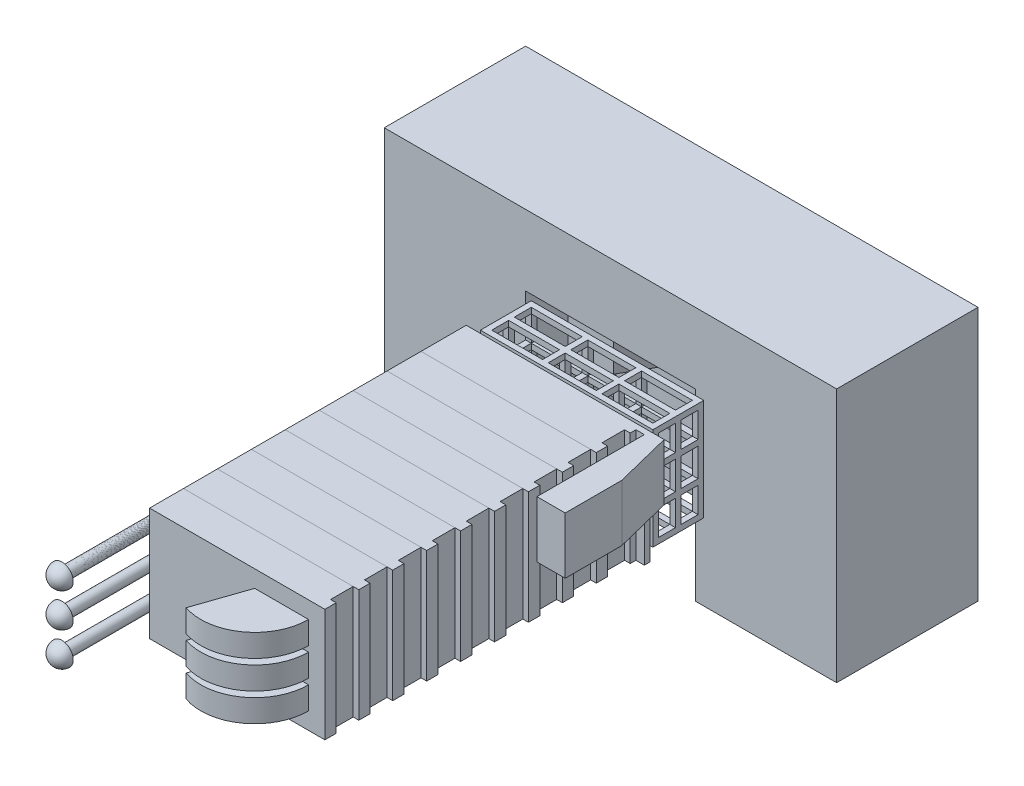
from build123d import *
from build123d.topology import SkipClean

# Parameters (mm, degrees)
SKETCH1_W             = 600
SKETCH1_H             = 400
SKETCH1_W_2           = 300
SKETCH1_H_2           = 346.666666667
SKETCH1_W_3           = 180
BOSS_EXTRUDE1_DEPTH   = 80
SKETCH2_W             = 620
SKETCH2_H             = 400
BOSS_EXTRUDE2_DEPTH   = 40
LPATTERN1_COUNT       = 9
LPATTERN1_PITCH       = 120
SKETCH3_W             = 530
SKETCH3_H             = 1040
CUT_EXTRUDE1_DEPTH    = 40
SKETCH4_W             = 620
SKETCH4_H             = 400
BOSS_EXTRUDE3_DEPTH   = 20
SKETCH5_W             = 650
SKETCH5_H             = 400
BOSS_EXTRUDE4_DEPTH   = 20
BOSS_EXTRUDE5_DEPTH   = 200
SKETCH8_R             = 20
BOSS_EXTRUDE6_DEPTH   = 1400
FILLET1_R             = 10
SKETCH10_W            = 150
SKETCH10_H            = 30
BOSS_EXTRUDE7_DEPTH   = 20
BOSS_EXTRUDE8_DEPTH   = 40
LPATTERN2_COUNT       = 2
LPATTERN2_PITCH       = 100
MIRROR1_COPY_1_DEPTH  = 40
MIRROR1_COPY_2_DEPTH  = 40
LPATTERN8_START       = -70
LPATTERN8_2_OUTLINE_R = 20
LPATTERN8_2_DEPTH     = 1430
LPATTERN8_3_DEPTH     = 30
FILLET2_R             = 10
FILLET2_OF_MIRROR3_R  = 10
SKETCH12_W            = 20
SKETCH12_H            = 90
SKETCH12_W_2          = 180
SKETCH12_H_2          = 20
SKETCH12_H_3          = 100
SKETCH12_W_3          = 170
SKETCH12_H_4          = 40
BOSS_EXTRUDE9_DEPTH   = 20
LPATTERN9_COUNT       = 3
LPATTERN9_PITCH       = 80
SKETCH13_W            = 20
SKETCH13_H            = 20
BOSS_EXTRUDE10_DEPTH  = 180
SKETCH15_W            = 1600
SKETCH15_H            = 900
BOSS_EXTRUDE12_DEPTH  = 500
SKETCH16_W            = 600
SKETCH16_H            = 400
CUT_EXTRUDE2_DEPTH    = 150
SKETCH17_W            = 360
SKETCH17_H            = 240
CUT_EXTRUDE3_DEPTH    = 150
CUT_EXTRUDE3_DRAFT    = -30
SKETCH18_W            = 600
SKETCH18_H            = 320
CUT_EXTRUDE4_DEPTH    = 400
BOSS_EXTRUDE13_DEPTH  = 10


with BuildPart() as part:
    # Sketch1 → Boss-Extrude1 (new body)
    with BuildSketch(Plane.XY):
        Rectangle(SKETCH1_W, SKETCH1_H)
        with Locations((-100, -6.666666666)):
            Rectangle(SKETCH1_W_2, SKETCH1_H_2, mode=Mode.SUBTRACT)
        with Locations((190, -6.666666666)):
            Rectangle(SKETCH1_W_3, SKETCH1_H_2, mode=Mode.SUBTRACT)
    extrude(amount=BOSS_EXTRUDE1_DEPTH)

    # Sketch2 → Boss-Extrude2 (add)
    with BuildSketch(Plane.XY.offset(80)):
        with Locations((10, 0)):
            Rectangle(SKETCH2_W, SKETCH2_H)
    extrude(amount=BOSS_EXTRUDE2_DEPTH)


with BuildPart() as lpattern1_1:
    # LPattern1: pattern copy
    add(part.part.moved(Location(Vector(0, 0, 1) * (1 * LPATTERN1_PITCH))))


with BuildPart() as lpattern1_2:
    # LPattern1: pattern copy
    add(part.part.moved(Location(Vector(0, 0, 1) * (2 * LPATTERN1_PITCH))))


with BuildPart() as lpattern1_3:
    # LPattern1: pattern copy
    add(part.part.moved(Location(Vector(0, 0, 1) * (3 * LPATTERN1_PITCH))))


with BuildPart() as lpattern1_4:
    # LPattern1: pattern copy
    add(part.part.moved(Location(Vector(0, 0, 1) * (4 * LPATTERN1_PITCH))))


with BuildPart() as lpattern1_5:
    # LPattern1: pattern copy
    add(part.part.moved(Location(Vector(0, 0, 1) * (5 * LPATTERN1_PITCH))))


with BuildPart() as lpattern1_6:
    # LPattern1: pattern copy
    add(part.part.moved(Location(Vector(0, 0, 1) * (6 * LPATTERN1_PITCH))))


with BuildPart() as lpattern1_7:
    # LPattern1: pattern copy
    add(part.part.moved(Location(Vector(0, 0, 1) * (7 * LPATTERN1_PITCH))))


with BuildPart() as lpattern1_8:
    # LPattern1: pattern copy
    add(part.part.moved(Location(Vector(0, 0, 1) * (8 * LPATTERN1_PITCH))))


with BuildPart() as cut_extrude1_tool:
    # Sketch3 → Cut-Extrude1 (new body)
    with BuildSketch(Plane.XZ.offset(200)):
        with Locations((15, 520)):
            Rectangle(SKETCH3_W, SKETCH3_H)
    extrude(amount=-CUT_EXTRUDE1_DEPTH)


with BuildPart() as part_1:
    add(part.part)

    # Cut-Extrude1: cut by cut_extrude1_tool
    add(cut_extrude1_tool.part, mode=Mode.SUBTRACT)

    # Sketch4 → Boss-Extrude3 (add)
    with BuildSketch(Plane(origin=(0, 0, 0), x_dir=(-1, 0, 0), z_dir=(0, 0, -1))):
        with Locations((-10, 0)):
            Rectangle(SKETCH4_W, SKETCH4_H)
    extrude(amount=BOSS_EXTRUDE3_DEPTH)

    # Sketch5 → Boss-Extrude4 (add)
    with BuildSketch(Plane(origin=(0, 0, -20), x_dir=(-1, 0, 0), z_dir=(0, 0, -1))):
        with Locations((-25, 0)):
            Rectangle(SKETCH5_W, SKETCH5_H)
    extrude(amount=BOSS_EXTRUDE4_DEPTH)

    # Sketch6 → Boss-Extrude5 (add)
    with BuildSketch(Plane(origin=(0, 0, 0), x_dir=(1, 0, 0), z_dir=(0, 1, 0))):
        Polygon((400, 40), (350, 40), (350, -360), (450, -360), (450, -160), align=None)
    extrude(amount=BOSS_EXTRUDE5_DEPTH)



with BuildPart() as lpattern1_1_1:
    add(lpattern1_1.part)

    # Cut-Extrude1: cut by cut_extrude1_tool
    add(cut_extrude1_tool.part, mode=Mode.SUBTRACT)


with BuildPart() as lpattern1_2_1:
    add(lpattern1_2.part)

    # Cut-Extrude1: cut by cut_extrude1_tool
    add(cut_extrude1_tool.part, mode=Mode.SUBTRACT)


with BuildPart() as lpattern1_3_1:
    add(lpattern1_3.part)

    # Cut-Extrude1: cut by cut_extrude1_tool
    add(cut_extrude1_tool.part, mode=Mode.SUBTRACT)


with BuildPart() as lpattern1_4_1:
    add(lpattern1_4.part)

    # Cut-Extrude1: cut by cut_extrude1_tool
    add(cut_extrude1_tool.part, mode=Mode.SUBTRACT)


with BuildPart() as lpattern1_5_1:
    add(lpattern1_5.part)

    # Cut-Extrude1: cut by cut_extrude1_tool
    add(cut_extrude1_tool.part, mode=Mode.SUBTRACT)


with BuildPart() as lpattern1_6_1:
    add(lpattern1_6.part)

    # Cut-Extrude1: cut by cut_extrude1_tool
    add(cut_extrude1_tool.part, mode=Mode.SUBTRACT)


with BuildPart() as lpattern1_7_1:
    add(lpattern1_7.part)

    # Cut-Extrude1: cut by cut_extrude1_tool
    add(cut_extrude1_tool.part, mode=Mode.SUBTRACT)


with BuildPart() as lpattern1_8_1:
    add(lpattern1_8.part)

    # Cut-Extrude1: cut by cut_extrude1_tool
    add(cut_extrude1_tool.part, mode=Mode.SUBTRACT)

    # Sketch11 → Boss-Extrude8 (add, symmetric)
    with BuildSketch(Plane(origin=(0, 0, 0), x_dir=(1, 0, 0), z_dir=(0, 1, 0))):
        with BuildLine():
            Line((10, -1260.443860597), (71.738792263, -1080))
            Line((71.738792263, -1080), (262.452360991, -1080))
            ThreePointArc((262.452360991, -1080), (182.637935397, -1235.15490759), (10, -1260.443860597))
        make_face()
    boss_extrude8 = extrude(amount=BOSS_EXTRUDE8_DEPTH, both=True)

    # LPattern2: Boss-Extrude8 ×2
    with Locations(*[(0, i * LPATTERN2_PITCH, 0) for i in range(1, LPATTERN2_COUNT)]):
        add(boss_extrude8)

    # Mirror1 copy 1 sketch → Mirror1 copy 1 (add, symmetric)
    with BuildSketch(Plane.XZ.offset(100)):
        with BuildLine():
            Line((10, 1260.443860597), (71.738792263, 1080))
            Line((71.738792263, 1080), (262.452360991, 1080))
            ThreePointArc((262.452360991, 1080), (182.637935397, 1235.15490759), (10, 1260.443860597))
        make_face()
    extrude(amount=MIRROR1_COPY_1_DEPTH, both=True)

    # Mirror1 copy 2 sketch → Mirror1 copy 2 (add, symmetric)
    with BuildSketch(Plane.XZ):
        with BuildLine():
            Line((10, 1260.443860597), (71.738792263, 1080))
            Line((71.738792263, 1080), (262.452360991, 1080))
            ThreePointArc((262.452360991, 1080), (182.637935397, 1235.15490759), (10, 1260.443860597))
        make_face()
    extrude(amount=MIRROR1_COPY_2_DEPTH, both=True)


with BuildPart() as body_10:
    # Sketch8 → Boss-Extrude6 (new body)
    with BuildSketch(Plane(origin=(0, 0, -40), x_dir=(-1, 0, 0), z_dir=(0, 0, -1))):
        with Locations((330, 0)):
            Circle(SKETCH8_R)
    extrude(amount=-BOSS_EXTRUDE6_DEPTH)

    # Sketch9 → Revolve1 (revolve)
    with SkipClean():  # the faces are left unmerged after this step: merging them gives an invalid solid
        with BuildSketch(Plane(origin=(0, 0, 0), x_dir=(1, 0, 0), z_dir=(0, 1, 0)), mode=Mode.PRIVATE) as revolve1_sk:
            with BuildLine():
                Line((-330, -1360), (-370, -1360))
                ThreePointArc((-370, -1360), (-358.284271247, -1388.284271247), (-330, -1400))
                Line((-330, -1400), (-330, -1360))
            make_face()
            with BuildLine():
                Line((-290, -1360), (-330, -1360))
                Line((-330, -1360), (-330, -1400))
                ThreePointArc((-330, -1400), (-301.715728753, -1388.284271247), (-290, -1360))
            make_face()
        revolve(revolve1_sk.sketch.rotate(Axis((-330, 0, 1293.375823625), (0, 0, 1)), 180), axis=Axis((-330, 0, 1293.375823625), (0, 0, 1)))
    add(body_10.part.scale(1), mode=Mode.REPLACE)  # the faces are merged on a copy

    # Fillet1
    fillet1_edges = [body_10.edges().sort_by_distance(p)[0] for p in [
        (-310, 0, 1360),
    ]]
    fillet(fillet1_edges, radius=FILLET1_R)


with BuildPart() as part_2:
    add(part_1.part)

    add(body_10.part)  # Boss-Extrude7 merges body 10
    # Sketch10 → Boss-Extrude7 (add, symmetric)
    with BuildSketch(Plane(origin=(0, 0, 0), x_dir=(1, 0, 0), z_dir=(0, 1, 0))):
        with Locations((-275, 55)):
            Rectangle(SKETCH10_W, SKETCH10_H)
    extrude(amount=BOSS_EXTRUDE7_DEPTH, both=True)

    # LPattern8 2 outline → LPattern8 2 (add)
    with BuildSketch(Plane.XY.offset(LPATTERN8_START)):
        with Locations((-330, 120)):
            Circle(LPATTERN8_2_OUTLINE_R)
    lpattern8_2 = extrude(amount=LPATTERN8_2_DEPTH)

    # LPattern8 3 outline → LPattern8 3 (add)
    with BuildSketch(Plane.XY.offset(LPATTERN8_START)):
        with BuildLine():
            Line((-350, 120), (-350, 100))
            Line((-350, 100), (-330, 100))
            ThreePointArc((-330, 100), (-344.142135624, 105.857864376), (-350, 120))
        make_face()
        with BuildLine():
            Line((-350, 140), (-350, 120))
            ThreePointArc((-350, 120), (-344.142135624, 134.142135624), (-330, 140))
            Line((-330, 140), (-350, 140))
        make_face()
        with BuildLine():
            ThreePointArc((-330, 140), (-310, 120), (-330, 100))
            Line((-330, 100), (-200, 100))
            Line((-200, 100), (-200, 140))
            Line((-200, 140), (-330, 140))
        make_face()
    lpattern8_3 = extrude(amount=LPATTERN8_3_DEPTH)

    # LPattern8 4 outline → LPattern8 4 (revolve)
    with BuildSketch(Plane(origin=(-330, 120, 0), x_dir=(1, 0, 0), z_dir=(0, -1, 0))):
        with BuildLine():
            Line((0, 1359.99999998), (40, 1359.99999996))
            ThreePointArc((40, 1359.99999996), (28.284271262, 1388.284271233), (0, 1400))
            Line((0, 1400), (0, 1359.99999998))
        make_face()
    lpattern8_4 = revolve(axis=Axis((-330, 120, 0), (0, 0, 1)))

    # Fillet2
    fillet2_edges = [part_2.edges().sort_by_distance(p)[0] for p in [
        (-350, 120, 1360),
    ]]
    fillet(fillet2_edges, radius=FILLET2_R)


with BuildPart() as body_10_2:
    # LPattern8: read off the stored shape, not the designer's step
    # LPattern8 outline → LPattern8 (revolve)
    with BuildSketch(Plane(origin=(-330, 120, 0), x_dir=(1, 0, 0), z_dir=(0, -1, 0))):
        with BuildLine():
            ThreePointArc((40, 1359.99999998), (28.284271255, 1388.28427124), (0, 1400))
            Line((0, 1400), (0, -40))
            Line((0, -40), (20, -40))
            Line((20, -40), (20, 1360))
            Line((20, 1360), (40, 1359.99999998))
        make_face()
    lpattern8 = revolve(axis=Axis((-330, 120, 0), (0, 0, 1)))


with BuildPart() as part_3:
    add(part_2.part)

    # Mirror3: LPattern8, LPattern8 2, LPattern8 3, LPattern8 4 across plane
    add(lpattern8.mirror(Plane.ZX))
    add(lpattern8_2.mirror(Plane.ZX))
    add(lpattern8_3.mirror(Plane.ZX))
    add(lpattern8_4.mirror(Plane.ZX))

    # Fillet2 of Mirror3
    fillet2_of_mirror3_edges = [part_3.edges().sort_by_distance(p)[0] for p in [
        (-350, -120, 1360),
    ]]
    fillet(fillet2_of_mirror3_edges, radius=FILLET2_OF_MIRROR3_R)

    # Sketch12 → Boss-Extrude9 (add)
    with BuildSketch(Plane(origin=(0, 0, -70), x_dir=(-1, 0, 0), z_dir=(0, 0, -1))):
        Polygon((280, -100), (280, 180), (-330, 180), (-330, -180), (280, -180), (280, -140), (260, -140), (260, -160), (80, -160), (60, -160), (-110, -160), (-130, -160), (-310, -160), (-310, -70), (-310, -50), (-310, 50), (-310, 70), (-310, 160), (-130, 160), (-110, 160), (60, 160), (80, 160), (260, 160), (260, 70), (260, 50), (260, -50), (260, -70), (260, -100), align=None)
        with Locations((-120, 115)):
            Rectangle(SKETCH12_W, SKETCH12_H)
        with Locations((-220, 60)):
            Rectangle(SKETCH12_W_2, SKETCH12_H_2)
        with Locations((-120, 60)):
            Rectangle(SKETCH12_W, SKETCH12_H_2)
        with Locations((-120, 0)):
            Rectangle(SKETCH12_W, SKETCH12_H_3)
        with Locations((-220, -60)):
            Rectangle(SKETCH12_W_2, SKETCH12_H_2)
        with Locations((-120, -60)):
            Rectangle(SKETCH12_W, SKETCH12_H_2)
        with Locations((-120, -115)):
            Rectangle(SKETCH12_W, SKETCH12_H)
        with Locations((-25, -60)):
            Rectangle(SKETCH12_W_3, SKETCH12_H_2)
        with Locations((70, -60)):
            Rectangle(SKETCH12_W, SKETCH12_H_2)
        with Locations((70, -115)):
            Rectangle(SKETCH12_W, SKETCH12_H)
        with Locations((170, -60)):
            Rectangle(SKETCH12_W_2, SKETCH12_H_2)
        with Locations((70, 60)):
            Rectangle(SKETCH12_W, SKETCH12_H_2)
        with Locations((-25, 60)):
            Rectangle(SKETCH12_W_3, SKETCH12_H_2)
        with Locations((70, 115)):
            Rectangle(SKETCH12_W, SKETCH12_H)
        with Locations((170, 60)):
            Rectangle(SKETCH12_W_2, SKETCH12_H_2)
        with Locations((270, -120)):
            Rectangle(SKETCH12_W, SKETCH12_H_4)
        with Locations((70, 0)):
            Rectangle(SKETCH12_W, SKETCH12_H_3)
    boss_extrude9 = extrude(amount=BOSS_EXTRUDE9_DEPTH)



with BuildPart() as lpattern9_1:
    # LPattern9: Boss-Extrude9 ×3
    with Locations(*[(0, 0, -i * LPATTERN9_PITCH) for i in range(1, LPATTERN9_COUNT)]):
        add(boss_extrude9)


with BuildPart() as part_4:
    add(part_3.part)

    add(lpattern9_1.part)  # Boss-Extrude10 merges LPattern9_1
    # Sketch13 → Boss-Extrude10 (add)
    with BuildSketch(Plane(origin=(0, 0, -250), x_dir=(-1, 0, 0), z_dir=(0, 0, -1))):
        with Locations((270, 170)):
            Rectangle(SKETCH13_W, SKETCH13_H)
        with Locations((270, 60)):
            Rectangle(SKETCH13_W, SKETCH13_H)
        with Locations((270, -60)):
            Rectangle(SKETCH13_W, SKETCH13_H)
        with Locations((270, -170)):
            Rectangle(SKETCH13_W, SKETCH13_H)
        with Locations((70, -170)):
            Rectangle(SKETCH13_W, SKETCH13_H)
        with Locations((70, -60)):
            Rectangle(SKETCH13_W, SKETCH13_H)
        with Locations((70, 60)):
            Rectangle(SKETCH13_W, SKETCH13_H)
        with Locations((70, 170)):
            Rectangle(SKETCH13_W, SKETCH13_H)
        with Locations((-120, 170)):
            Rectangle(SKETCH13_W, SKETCH13_H)
        with Locations((-120, -60)):
            Rectangle(SKETCH13_W, SKETCH13_H)
        with Locations((-120, 60)):
            Rectangle(SKETCH13_W, SKETCH13_H)
        with Locations((-120, -170)):
            Rectangle(SKETCH13_W, SKETCH13_H)
        with Locations((-320, -170)):
            Rectangle(SKETCH13_W, SKETCH13_H)
        with Locations((-320, -60)):
            Rectangle(SKETCH13_W, SKETCH13_H)
        with Locations((-320, 60)):
            Rectangle(SKETCH13_W, SKETCH13_H)
        with Locations((-320, 170)):
            Rectangle(SKETCH13_W, SKETCH13_H)
    extrude(amount=-BOSS_EXTRUDE10_DEPTH)

    # Sketch19 → Boss-Extrude13 (add)
    with BuildSketch(Plane(origin=(0, 0, 0), x_dir=(1, 0, 0), z_dir=(0, 1, 0))):
        Polygon((400, 40), (330, 70), (305, 70), (375, 40), align=None)
    extrude(amount=BOSS_EXTRUDE13_DEPTH)


with BuildPart() as body_11:
    # Sketch15 → Boss-Extrude12 (new body)
    with BuildSketch(Plane(origin=(0, 0, -250), x_dir=(-1, 0, 0), z_dir=(0, 0, -1))):
        Rectangle(SKETCH15_W, SKETCH15_H)
    extrude(amount=BOSS_EXTRUDE12_DEPTH)

    # Sketch16 → Cut-Extrude2 (cut)
    with BuildSketch(Plane.XY.offset(-250)):
        Rectangle(SKETCH16_W, SKETCH16_H)
    extrude(amount=-CUT_EXTRUDE2_DEPTH, mode=Mode.SUBTRACT)


with BuildPart() as cut_extrude3_tool:
    # Sketch17 → Cut-Extrude3 (with draft: the straight prism first)
    with BuildSketch(Plane.XY.offset(-400)):
        with Locations((40, 0)):
            Rectangle(SKETCH17_W, SKETCH17_H)
    extrude(amount=-CUT_EXTRUDE3_DEPTH)
    # Cut-Extrude3: the draft: its side faces are tilted about the plane it starts from
    cut_extrude3_sides = [cut_extrude3_tool.faces().sort_by_distance(p)[0] for p in [
        (40, 120, -475),
        (-140, 0, -475),
        (40, -120, -475),
        (220, 0, -475),
    ]]
    draft(cut_extrude3_sides, Plane.XY.offset(-400), CUT_EXTRUDE3_DRAFT)


with BuildPart() as body_11_1:
    add(body_11.part)

    # Cut-Extrude3: cut by cut_extrude3_tool
    add(cut_extrude3_tool.part, mode=Mode.SUBTRACT)

    # Sketch18 → Cut-Extrude4 (cut)
    with BuildSketch(Plane.XZ.offset(450)):
        with Locations((0, -410)):
            Rectangle(SKETCH18_W, SKETCH18_H)
    extrude(amount=-CUT_EXTRUDE4_DEPTH, mode=Mode.SUBTRACT)


solid = Compound([lpattern1_1_1.part, lpattern1_2_1.part, lpattern1_3_1.part, lpattern1_4_1.part, lpattern1_5_1.part, lpattern1_6_1.part, lpattern1_7_1.part, lpattern1_8_1.part, body_10_2.part, part_4.part, body_11_1.part])
